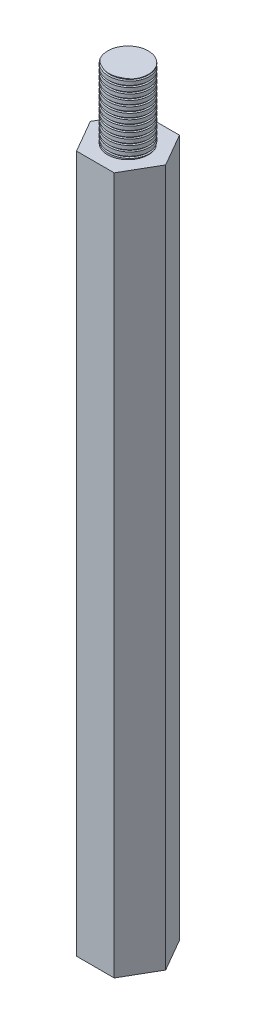
from build123d import *

# Parameters (mm, degrees)
SKETCH_1_R          = 1.46
EXTRUDE_1_DEPTH     = 50
SKETCH_1_3_R        = 1.46
CUT_EXTRUDE_1_DEPTH = 5
SKETCH_2_R          = 1.46
EXTRUDE_2_DEPTH     = 5
SWEEP_1_PITCH       = 0.4
SWEEP_1_FROM        = -0.1
SWEEP_2_PITCH       = 0.4


with BuildPart() as part:
    # 草图1 → 凸台-拉伸1 (new body)
    # profile 1 of 2: a face of its own
    with BuildSketch(Plane(origin=(0, 0, 0), x_dir=(1, 0, 0), z_dir=(0, 1, 0))):
        Polygon((-2.70199926, 0), (-1.35099963, -2.34), (1.35099963, -2.34), (2.70199926, 0), (1.35099963, 2.34), (-1.35099963, 2.34), align=None)
        Circle(SKETCH_1_R, mode=Mode.SUBTRACT)
    # profile 2 of 2: a face of its own
    with BuildSketch(Plane(origin=(0, 0, 0), x_dir=(1, 0, 0), z_dir=(0, 1, 0))):
        Circle(SKETCH_1_R)
    extrude(amount=EXTRUDE_1_DEPTH)

    # 草图1<3> → 切除-拉伸1 (cut)
    with BuildSketch(Plane(origin=(0, 0, 0), x_dir=(1, 0, 0), z_dir=(0, 1, 0))):
        with Locations(Location((0, 0, 0), (0, 0, 270))):
            Circle(SKETCH_1_3_R)
    extrude(amount=CUT_EXTRUDE_1_DEPTH, mode=Mode.SUBTRACT)

    # 切除-扫描2: arcs per turn and ends read off the stored shape
    # 切除-扫描2: the profile of 草图7 profile screwed along a right-hand helix through 23.75 turns, 6 arcs to a turn; built about Z, then put on its axis
    sweep_2_z = Axis((0, 0, 0), (0, 0, 1))
    sweep_2_corners = [(1.4597, 0, 0.1001), (1.66, 0, 0.033333333), (1.66, 0, -0.033333333), (1.4597, 0, -0.1001)]
    with BuildLine(mode=Mode.PRIVATE) as sweep_2_profile:
        Line(sweep_2_corners[0], sweep_2_corners[1])
        Line(sweep_2_corners[1], sweep_2_corners[2])
        Line(sweep_2_corners[2], sweep_2_corners[3])
        Line(sweep_2_corners[3], sweep_2_corners[0])
    sweep_2_cap = Face(sweep_2_profile.wire())
    sweep_2_turn_angles = [0, 30, 60, 90, 120, 150, 180, 210, 240, 270, 300, 330, 360]
    sweep_2_turn_weights = [1, 0.8660254037844387, 1, 0.8660254037844387, 1, 0.8660254037844387, 1, 0.8660254037844387, 1, 0.8660254037844387, 1, 0.8660254037844387, 1]
    sweep_2_turn_rails = [Edge.make_bspline([Vector(p[0], p[1], 0).rotate(sweep_2_z, sweep_2_turn_angles[k]) / sweep_2_turn_weights[k] + Vector(0, 0, p[2] + SWEEP_2_PITCH * sweep_2_turn_angles[k] / 360) for k in range(13)], [0, 0, 0, 1, 1, 2, 2, 3, 3, 4, 4, 5, 5, 6, 6, 6], 2, sweep_2_turn_weights) for p in sweep_2_corners]
    sweep_2_turn_sides = [Face.make_surface_from_curves(sweep_2_turn_rails[p[0]], sweep_2_turn_rails[p[1]]) for p in [(0, 1), (1, 2), (2, 3), (3, 0)]]
    sweep_2_last_angles = [8280, 8310, 8340, 8370, 8400, 8430, 8460, 8490, 8520, 8535, 8550]
    sweep_2_last_weights = [1, 0.8660254037844387, 1, 0.8660254037844387, 1, 0.8660254037844387, 1, 0.8660254037844387, 1, 0.965925826289056, 1]
    sweep_2_last_rails = [Edge.make_bspline([Vector(p[0], p[1], 0).rotate(sweep_2_z, sweep_2_last_angles[k]) / sweep_2_last_weights[k] + Vector(0, 0, p[2] + SWEEP_2_PITCH * sweep_2_last_angles[k] / 360) for k in range(11)], [0, 0, 0, 1, 1, 2, 2, 3, 3, 4, 4, 5, 5, 5], 2, sweep_2_last_weights) for p in sweep_2_corners]
    sweep_2_last_sides = [Face.make_surface_from_curves(sweep_2_last_rails[p[0]], sweep_2_last_rails[p[1]]) for p in [(0, 1), (1, 2), (2, 3), (3, 0)]]
    sweep_2 = Plane(origin=(0, 0, 0), x_dir=(0, 0, -1), z_dir=(0, 1, 0)) * Solid(Shell([*[p.moved(Location((0, 0, SWEEP_2_PITCH * i))) for i in range(23) for p in sweep_2_turn_sides], *sweep_2_last_sides, sweep_2_cap, sweep_2_cap.rotate(sweep_2_z, 8550).moved(Location((0, 0, SWEEP_2_PITCH * 8550 / 360)))]))
    add(sweep_2, mode=Mode.SUBTRACT)


with BuildPart() as body_2:
    # 草图2 → 凸台-拉伸2 (new body)
    with BuildSketch(Plane(origin=(0, 50, 0), x_dir=(1, 0, 0), z_dir=(0, 1, 0))):
        with Locations(Location((0, 0, 0), (0, 0, 270))):
            Circle(SKETCH_2_R)
    extrude(amount=EXTRUDE_2_DEPTH)

    # 切除-扫描1: arcs per turn and ends read off the stored shape
    # 切除-扫描1: the profile of 草图4 screwed along a left-hand helix through 18.75 turns, 6 arcs to a turn; built about Z, then put on its axis
    sweep_1_z = Axis((0, 0, 0), (0, 0, 1))
    sweep_1_corners = [(1.56, 5.45e-07, -0.400000022), (1.56, 5.45e-07, -0.200000022), (1.36, 4.75e-07, -0.266666689), (1.36, 4.75e-07, -0.333333356)]
    with BuildLine(mode=Mode.PRIVATE) as sweep_1_profile:
        Line(sweep_1_corners[0], sweep_1_corners[1])
        Line(sweep_1_corners[1], sweep_1_corners[2])
        Line(sweep_1_corners[2], sweep_1_corners[3])
        Line(sweep_1_corners[3], sweep_1_corners[0])
    sweep_1_cap = Face(sweep_1_profile.wire())
    sweep_1_turn_angles = [0, -30, -60, -90, -120, -150, -180, -210, -240, -270, -300, -330, -360]
    sweep_1_turn_weights = [1, 0.8660254037844387, 1, 0.8660254037844387, 1, 0.8660254037844387, 1, 0.8660254037844387, 1, 0.8660254037844387, 1, 0.8660254037844387, 1]
    sweep_1_turn_rails = [Edge.make_bspline([Vector(p[0], p[1], 0).rotate(sweep_1_z, sweep_1_turn_angles[k]) / sweep_1_turn_weights[k] + Vector(0, 0, p[2] + -SWEEP_1_PITCH * sweep_1_turn_angles[k] / 360) for k in range(13)], [0, 0, 0, 1, 1, 2, 2, 3, 3, 4, 4, 5, 5, 6, 6, 6], 2, sweep_1_turn_weights) for p in sweep_1_corners]
    sweep_1_turn_sides = [Face.make_surface_from_curves(sweep_1_turn_rails[p[0]], sweep_1_turn_rails[p[1]]) for p in [(0, 1), (1, 2), (2, 3), (3, 0)]]
    sweep_1_last_angles = [-6480, -6510, -6540, -6570, -6600, -6630, -6660, -6690, -6720, -6735, -6750]
    sweep_1_last_weights = [1, 0.8660254037844387, 1, 0.8660254037844387, 1, 0.8660254037844387, 1, 0.8660254037844387, 1, 0.965925826288941, 1]
    sweep_1_last_rails = [Edge.make_bspline([Vector(p[0], p[1], 0).rotate(sweep_1_z, sweep_1_last_angles[k]) / sweep_1_last_weights[k] + Vector(0, 0, p[2] + -SWEEP_1_PITCH * sweep_1_last_angles[k] / 360) for k in range(11)], [0, 0, 0, 1, 1, 2, 2, 3, 3, 4, 4, 5, 5, 5], 2, sweep_1_last_weights) for p in sweep_1_corners]
    sweep_1_last_sides = [Face.make_surface_from_curves(sweep_1_last_rails[p[0]], sweep_1_last_rails[p[1]]) for p in [(0, 1), (1, 2), (2, 3), (3, 0)]]
    sweep_1 = Plane(origin=(0, 50.1, 0), x_dir=(0, 0, 1), z_dir=(0, 1, 0)) * split(Solid(Shell([*[p.moved(Location((0, 0, SWEEP_1_PITCH * i))) for i in range(18) for p in sweep_1_turn_sides], *sweep_1_last_sides, sweep_1_cap, sweep_1_cap.rotate(sweep_1_z, -6750).moved(Location((0, 0, -SWEEP_1_PITCH * -6750 / 360)))])), bisect_by=Plane.XY.offset(SWEEP_1_FROM), keep=Keep.TOP, mode=Mode.PRIVATE)
    add(sweep_1, mode=Mode.SUBTRACT)


solid = Compound([part.part, body_2.part])
